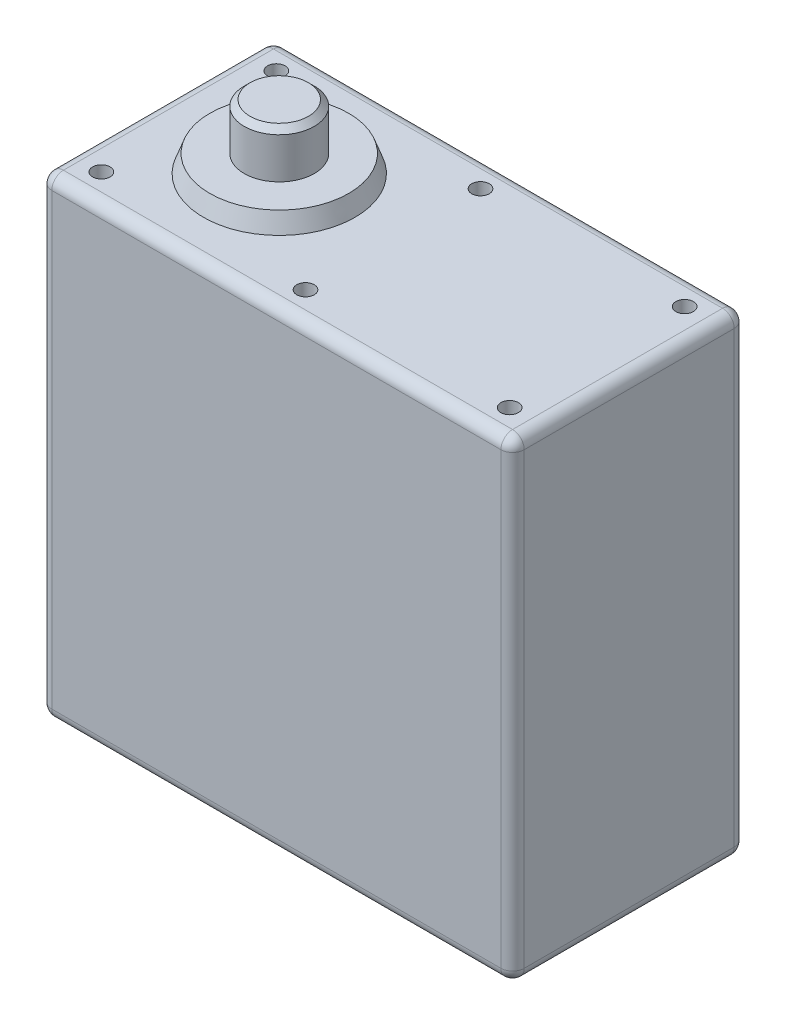
from build123d import *

# Parameters (mm, degrees)
SKETCH_1_W          = 40.5
SKETCH_1_H          = 40.5
EXTRUDE_1_DEPTH     = 20
SKETCH_2_R          = 6.5
EXTRUDE_2_DEPTH     = 1.5
SKETCH_5_R          = 0.75
CUT_EXTRUDE_1_DEPTH = 50.500631309
SKETCH_12_R         = 3
EXTRUDE_3_DEPTH     = 4
CHAMFER_1_SIZE2     = 0.545955351
CHAMFER_1_SIZE      = 1.5
CHAMFER_2_SIZE      = 0.5
EXTRUDE_START       = 1.5
SKETCH_18_R         = 3
SKETCH_18_R_2       = 1.25
EXTRUDE_4_DEPTH     = 1.5
FILLET_2_R          = 1
FILLET_3_R          = 1


with BuildPart() as part:
    # 草圖1 → 伸長1 (new body)
    with BuildSketch(Plane.XY):
        Rectangle(SKETCH_1_W, SKETCH_1_H)
    extrude(amount=EXTRUDE_1_DEPTH)

    # 草圖2 → 伸長2 (add)
    with BuildSketch(Plane(origin=(0, 20.25, 0), x_dir=(1, 0, 0), z_dir=(0, 1, 0))):
        with Locations(Location((-9.75, -10, 0), (0, 0, 90))):
            Circle(SKETCH_2_R)
    extrude(amount=EXTRUDE_2_DEPTH)

    # 草圖5 → 除料-伸長1 (cut, through all)
    with BuildSketch(Plane(origin=(0, 20.25, 0), x_dir=(1, 0, 0), z_dir=(0, 1, 0))):
        with Locations(Location((-17.5, -2.5, 0), (0, 0, 270))):
            Circle(SKETCH_5_R)
        with Locations(Location((0, -2.5, 0), (0, 0, 270))):
            Circle(SKETCH_5_R)
        with Locations(Location((17.5, -2.5, 0), (0, 0, 270))):
            Circle(SKETCH_5_R)
        with Locations(Location((17.5, -17.5, 0), (0, 0, 90))):
            Circle(SKETCH_5_R)
        with Locations(Location((0, -17.5, 0), (0, 0, 90))):
            Circle(SKETCH_5_R)
        with Locations(Location((-17.5, -17.5, 0), (0, 0, 90))):
            Circle(SKETCH_5_R)
    extrude(amount=-CUT_EXTRUDE_1_DEPTH, mode=Mode.SUBTRACT)

    # 草圖12 → 伸長3 (add)
    with BuildSketch(Plane(origin=(0, 21.75, 0), x_dir=(1, 0, 0), z_dir=(0, 1, 0))):
        with Locations(Location((-9.75, -10, 0), (0, 0, 270))):
            Circle(SKETCH_12_R)
    extrude(amount=EXTRUDE_3_DEPTH)

    # 導角1
    chamfer_1_edges = [part.edges().sort_by_distance(p)[0] for p in [
        (-9.75, 21.75, 16.5),
    ]]
    chamfer_1_side = [part.faces().sort_by_distance(p)[0] for p in [
        (-9.75, 21.739080893, 16.5),
    ]]
    chamfer(chamfer_1_edges, length=CHAMFER_1_SIZE - 0.0001, length2=CHAMFER_1_SIZE2 - 0.0001, reference=chamfer_1_side[0])  # a hair under: the kernel refuses the full size

    # 導角2
    chamfer_2_edges = [part.edges().sort_by_distance(p)[0] for p in [
        (-9.75, 25.75, 7),
    ]]
    chamfer(chamfer_2_edges, length=CHAMFER_2_SIZE)

    # 草圖18 → 伸長4 (add)
    with BuildSketch(Plane.XZ.offset(20.25).offset(EXTRUDE_START)):
        with Locations(Location((-9.75, 10, 0), (0, 0, 90))):
            Circle(SKETCH_18_R)
        with Locations(Location((-9.75, 10, 0), (0, 0, 270))):
            Circle(SKETCH_18_R_2, mode=Mode.SUBTRACT)
    extrude(amount=-EXTRUDE_4_DEPTH)

    # 圓角2
    fillet_2_edges = [part.edges().sort_by_distance(p)[0] for p in [
        (20.25, 0, 20),
        (-20.25, 0, 20),
        (20.25, 0, 0),
        (-20.25, 0, 0),
    ]]
    fillet(fillet_2_edges, radius=FILLET_2_R)

    # 圓角3
    fillet_3_edges = [part.edges().sort_by_distance(p)[0] for p in [
        (0, -20.25, 20),
        (0, 20.25, 20),
        (0, 20.25, 0),
        (-20.25, 20.25, 10),
        (20.25, 20.25, 10),
        (-19.957106781, 20.25, 19.707106781),
        (-19.957106781, 20.25, 0.292893219),
        (19.957106781, 20.25, 0.292893219),
        (19.957106781, 20.25, 19.707106781),
        (20.25, -20.25, 10),
        (0, -20.25, 0),
        (-20.25, -20.25, 10),
        (-19.957106781, -20.25, 19.707106781),
        (-19.957106781, -20.25, 0.292893219),
        (19.957106781, -20.25, 0.292893219),
        (19.957106781, -20.25, 19.707106781),
    ]]
    fillet(fillet_3_edges, radius=FILLET_3_R)


solid = part.part
